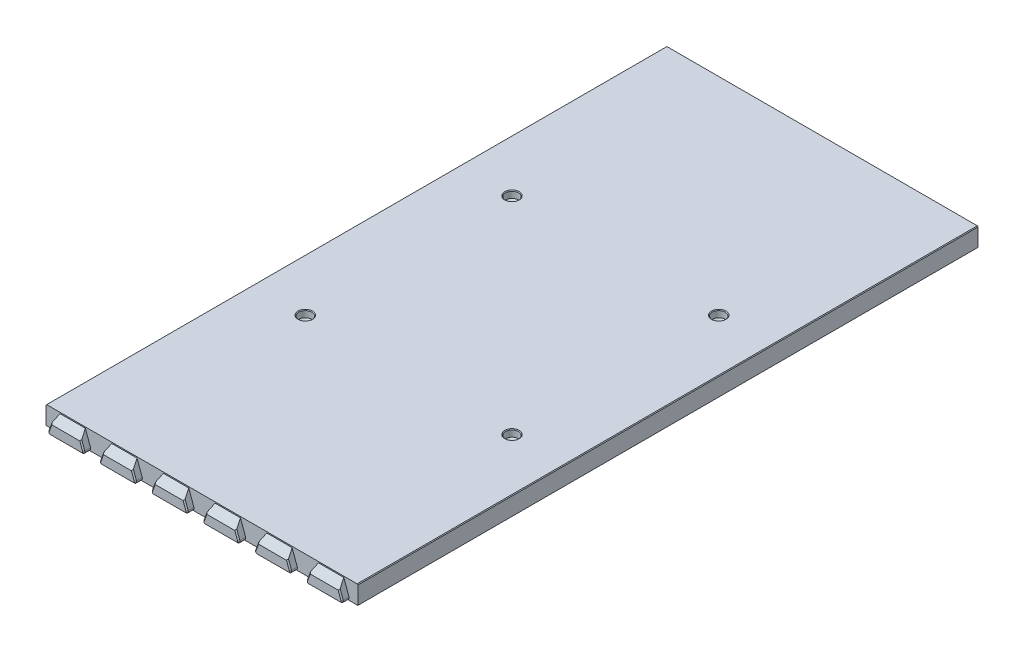
from build123d import *

# Parameters (mm, degrees)
BOSS_EXTRUDE1_DEPTH             = 135
SKETCH7_W                       = 131.75
SKETCH7_H                       = 6
BOSS_EXTRUDE7_DEPTH             = 1
BOSS_EXTRUDE4_DEPTH             = 3
BOSS_EXTRUDE8_REACH             = 153.314
BOSS_EXTRUDE8_DIRECTION_2_DEPTH = 2
CHAMFER4_SIZE                   = 0.5
FILLET4_R                       = 1
CHAMFER6_SIZE                   = 0.5
FILLET2_R                       = 2
CHAMFER4_OF_MIRROR2_SIZE        = 0.5
FILLET4_OF_MIRROR2_R            = 1
CHAMFER6_OF_MIRROR2_SIZE        = 0.5
FILLET2_OF_MIRROR2_R            = 2
BOSS_EXTRUDE9_REACH             = 283.425
SKETCH9_R                       = 5
FILLET3_R                       = 3
SKETCH10_R                      = 1.85
CUT_EXTRUDE2_DEPTH              = 282.42497335
SKETCH11_R                      = 2.85
CUT_EXTRUDE3_DEPTH              = 3
CHAMFER7_SIZE                   = 1
CUT_EXTRUDE4_DEPTH              = 282.42497335
CUT_EXTRUDE4_DEPTH_BACK         = 282.42497335
CHAMFER8_SIZE                   = 0.3


with BuildPart() as part:
    # Sketch1 → Boss-Extrude1 (new body)
    with BuildSketch(Plane.XY):
        Polygon((-67.875, 0), (-67.875, 8), (67.875, 8), (67.875, 0), (65.875, 0), (65.875, 6), (-65.875, 6), (-65.875, 0), align=None)
    boss_extrude1 = extrude(amount=-BOSS_EXTRUDE1_DEPTH)

    # Sketch7 → Boss-Extrude7 (add)
    with BuildSketch(Plane.XY):
        with Locations((0, 3)):
            Rectangle(SKETCH7_W, SKETCH7_H)
    boss_extrude7 = extrude(amount=-BOSS_EXTRUDE7_DEPTH)

    # Sketch2 → Boss-Extrude4 (add)
    with BuildSketch(Plane.XY):
        Polygon((50.911761874, 8), (48, 0), (64.5, 0), (61.588238126, 8), align=None)
        Polygon((28.411761874, 8), (25.5, 0), (42, 0), (39.088238126, 8), align=None)
        Polygon((5.911761874, 8), (3, 0), (19.5, 0), (16.588238126, 8), align=None)
        Polygon((-16.588238126, 8), (-19.5, 0), (-3, 0), (-5.911761874, 8), align=None)
        Polygon((-39.088238126, 8), (-42, 0), (-25.5, 0), (-28.411761874, 8), align=None)
        Polygon((-61.588238126, 8), (-64.5, 0), (-48, 0), (-50.911761874, 8), align=None)
    boss_extrude4 = extrude(amount=BOSS_EXTRUDE4_DEPTH)

    # Sketch8 → Boss-Extrude8 (add, up to next)
    with BuildSketch(Plane.XZ, mode=Mode.PRIVATE) as boss_extrude8_sk1:
        Polygon((-66.35, -20.258341264), (-62.65, -21.605031131), (-62.65, -23.394968869), (-66.35, -24.741658736), align=None)
    boss_extrude8_tool1 = extrude(boss_extrude8_sk1.sketch, amount=-BOSS_EXTRUDE8_REACH, mode=Mode.PRIVATE) - part.part
    # Sketch8 → Boss-Extrude8 (add, up to next)
    with BuildSketch(Plane.XZ, mode=Mode.PRIVATE) as boss_extrude8_sk2:
        Polygon((-66.35, -132.758341264), (-62.65, -134.105031131), (-62.65, -134.85), (-62.65, -135), (-66.35, -135), (-66.35, -134.85), align=None)
    boss_extrude8_tool2 = extrude(boss_extrude8_sk2.sketch, amount=-BOSS_EXTRUDE8_REACH, mode=Mode.PRIVATE) - part.part
    # Sketch8 → Boss-Extrude8 (add, up to next)
    with BuildSketch(Plane.XZ, mode=Mode.PRIVATE) as boss_extrude8_sk3:
        Polygon((66.35, -24.741658736), (66.35, -20.258341264), (62.65, -21.605031131), (62.65, -23.394968869), align=None)
    boss_extrude8_tool3 = extrude(boss_extrude8_sk3.sketch, amount=-BOSS_EXTRUDE8_REACH, mode=Mode.PRIVATE) - part.part
    # Sketch8 → Boss-Extrude8 (add, up to next)
    with BuildSketch(Plane.XZ, mode=Mode.PRIVATE) as boss_extrude8_sk4:
        Polygon((66.35, -135), (62.65, -135), (62.65, -134.85), (62.65, -134.105031131), (66.35, -132.758341264), (66.35, -134.85), align=None)
    boss_extrude8_tool4 = extrude(boss_extrude8_sk4.sketch, amount=-BOSS_EXTRUDE8_REACH, mode=Mode.PRIVATE) - part.part
    boss_extrude8_1 = boss_extrude8_tool1.solids().sort_by_distance((-64.764762, 0, -22.5))[0]
    add(boss_extrude8_1)
    boss_extrude8_2 = boss_extrude8_tool2.solids().sort_by_distance((-64.764762, 0, -134.16766))[0]
    add(boss_extrude8_2)
    boss_extrude8_3 = boss_extrude8_tool3.solids().sort_by_distance((64.764762, 0, -22.5))[0]
    add(boss_extrude8_3)
    boss_extrude8_4 = boss_extrude8_tool4.solids().sort_by_distance((64.764762, 0, -134.16766))[0]
    add(boss_extrude8_4)
    boss_extrude8 = boss_extrude8_1 + boss_extrude8_2 + boss_extrude8_3 + boss_extrude8_4  # Boss-Extrude8 as one shape, for the pattern or mirror that repeats it

    # Sketch8 → Boss-Extrude8 direction 2 (add)
    with BuildSketch(Plane.XZ):
        Polygon((-66.35, -20.258341264), (-62.65, -21.605031131), (-62.65, -23.394968869), (-66.35, -24.741658736), align=None)
        Polygon((-66.35, -132.758341264), (-62.65, -134.105031131), (-62.65, -134.85), (-62.65, -135), (-66.35, -135), (-66.35, -134.85), align=None)
        Polygon((66.35, -24.741658736), (66.35, -20.258341264), (62.65, -21.605031131), (62.65, -23.394968869), align=None)
        Polygon((66.35, -135), (62.65, -135), (62.65, -134.85), (62.65, -134.105031131), (66.35, -132.758341264), (66.35, -134.85), align=None)
    boss_extrude8_direction_2 = extrude(amount=BOSS_EXTRUDE8_DIRECTION_2_DEPTH)

    # Chamfer4
    chamfer4_edges = [part.edges().sort_by_distance(p)[0] for p in [
        (-66.35, -2, -22.5),
        (-64.5, -2, -24.068313803),
        (-62.65, -2, -22.5),
        (-64.5, -2, -20.931686197),
        (-66.35, -2, -133.879170632),
        (-62.65, -2, -134.552515565),
        (-64.5, -2, -133.431686197),
        (66.35, -2, -133.879170632),
        (64.5, -2, -133.431686197),
        (62.65, -2, -134.552515565),
        (64.5, -2, -24.068313803),
        (66.35, -2, -22.5),
        (64.5, -2, -20.931686197),
        (62.65, -2, -22.5),
    ]]
    chamfer(chamfer4_edges, length=CHAMFER4_SIZE)

    # Fillet4
    fillet4_edges = [part.edges().sort_by_distance(p)[0] for p in [
        (-64.5, 0, 1.5),
        (-48, 0, 1.5),
        (48, 0, 1.5),
        (64.5, 0, 1.5),
        (25.5, 0, 1.5),
        (42, 0, 1.5),
        (3, 0, 1.5),
        (19.5, 0, 1.5),
        (-42, 0, 1.5),
        (-25.5, 0, 1.5),
        (-19.5, 0, 1.5),
        (-3, 0, 1.5),
    ]]
    fillet(fillet4_edges, radius=FILLET4_R)

    # Chamfer6
    chamfer6_edges = [part.edges().sort_by_distance(p)[0] for p in [
        (-62.79989137, 4.671010072, 3),
        (62.79989137, 4.671010072, 3),
        (56.25, 0, 3),
        (33.75, 0, 3),
        (11.25, 0, 3),
        (-11.25, 0, 3),
        (-33.75, 0, 3),
        (-56.25, 0, 3),
        (48.608995962, 0.426423564, 3),
        (63.891004038, 0.426423564, 3),
        (40.29989137, 4.671010072, 3),
        (26.108995962, 0.426423564, 3),
        (41.391004038, 0.426423564, 3),
        (17.79989137, 4.671010072, 3),
        (3.608995962, 0.426423564, 3),
        (18.891004038, 0.426423564, 3),
        (-4.70010863, 4.671010072, 3),
        (-18.891004038, 0.426423564, 3),
        (-3.608995962, 0.426423564, 3),
        (-27.20010863, 4.671010072, 3),
        (-41.391004038, 0.426423564, 3),
        (-26.108995962, 0.426423564, 3),
        (-49.70010863, 4.671010072, 3),
        (-63.891004038, 0.426423564, 3),
        (-48.608995962, 0.426423564, 3),
        (49.70010863, 4.671010072, 3),
        (27.20010863, 4.671010072, 3),
        (4.70010863, 4.671010072, 3),
        (-40.29989137, 4.671010072, 3),
        (-17.79989137, 4.671010072, 3),
    ]]
    chamfer(chamfer6_edges, length=CHAMFER6_SIZE)

    # Fillet2
    fillet2_edges = [part.edges().sort_by_distance(p)[0] for p in [
        (-65.875, 6, -10.715613563),
        (-65.875, 3, -24.568772875),
        (-65.875, 3, -20.431227125),
        (-64.2625, 6, -23.981870872),
        (-64.2625, 6, -21.018129128),
        (-62.65, 6, -22.5),
        (-65.875, 6, -78.75),
        (-65.875, 3, -132.931227125),
        (-62.65, 6, -134.552515565),
        (-64.2625, 6, -133.518129128),
        (65.875, 6, -78.75),
        (65.875, 3, -132.931227125),
        (64.2625, 6, -133.518129128),
        (62.65, 6, -134.552515565),
        (65.875, 6, -10.715613563),
        (65.875, 3, -24.568772875),
        (65.875, 3, -20.431227125),
        (64.2625, 6, -23.981870872),
        (62.65, 6, -22.5),
        (64.2625, 6, -21.018129128),
        (-65.875, 3, -1),
        (0, 6, -1),
        (65.875, 3, -1),
    ]]
    fillet(fillet2_edges, radius=FILLET2_R)


with BuildPart() as mirror2_1:
    # Mirror2: Boss-Extrude1, Boss-Extrude7, Boss-Extrude4, Boss-Extrude8, Boss-Extrude8 direction 2 across plane
    add(boss_extrude1.mirror(Plane.XY.offset(-135)))
    add(boss_extrude7.mirror(Plane.XY.offset(-135)))
    add(boss_extrude4.mirror(Plane.XY.offset(-135)))
    add(boss_extrude8.mirror(Plane.XY.offset(-135)))
    add(boss_extrude8_direction_2.mirror(Plane.XY.offset(-135)))

    # Chamfer4 of Mirror2
    chamfer4_of_mirror2_edges = [mirror2_1.edges().sort_by_distance(p)[0] for p in [
        (-66.35, -2, -247.5),
        (-64.5, -2, -245.931686197),
        (-62.65, -2, -247.5),
        (-64.5, -2, -249.068313803),
        (-66.35, -2, -136.120829368),
        (-62.65, -2, -135.447484435),
        (-64.5, -2, -136.568313803),
        (66.35, -2, -136.120829368),
        (64.5, -2, -136.568313803),
        (62.65, -2, -135.447484435),
        (64.5, -2, -245.931686197),
        (66.35, -2, -247.5),
        (64.5, -2, -249.068313803),
        (62.65, -2, -247.5),
    ]]
    chamfer(chamfer4_of_mirror2_edges, length=CHAMFER4_OF_MIRROR2_SIZE)

    # Fillet4 of Mirror2
    fillet4_of_mirror2_edges = [mirror2_1.edges().sort_by_distance(p)[0] for p in [
        (-64.5, 0, -271.5),
        (-48, 0, -271.5),
        (48, 0, -271.5),
        (64.5, 0, -271.5),
        (25.5, 0, -271.5),
        (42, 0, -271.5),
        (3, 0, -271.5),
        (19.5, 0, -271.5),
        (-42, 0, -271.5),
        (-25.5, 0, -271.5),
        (-19.5, 0, -271.5),
        (-3, 0, -271.5),
    ]]
    fillet(fillet4_of_mirror2_edges, radius=FILLET4_OF_MIRROR2_R)

    # Chamfer6 of Mirror2
    chamfer6_of_mirror2_edges = [mirror2_1.edges().sort_by_distance(p)[0] for p in [
        (-62.79989137, 4.671010072, -273),
        (62.79989137, 4.671010072, -273),
        (56.25, 0, -273),
        (33.75, 0, -273),
        (11.25, 0, -273),
        (-11.25, 0, -273),
        (-33.75, 0, -273),
        (-56.25, 0, -273),
        (48.608995962, 0.426423564, -273),
        (63.891004038, 0.426423564, -273),
        (40.29989137, 4.671010072, -273),
        (26.108995962, 0.426423564, -273),
        (41.391004038, 0.426423564, -273),
        (17.79989137, 4.671010072, -273),
        (3.608995962, 0.426423564, -273),
        (18.891004038, 0.426423564, -273),
        (-4.70010863, 4.671010072, -273),
        (-18.891004038, 0.426423564, -273),
        (-3.608995962, 0.426423564, -273),
        (-27.20010863, 4.671010072, -273),
        (-41.391004038, 0.426423564, -273),
        (-26.108995962, 0.426423564, -273),
        (-49.70010863, 4.671010072, -273),
        (-63.891004038, 0.426423564, -273),
        (-48.608995962, 0.426423564, -273),
        (49.70010863, 4.671010072, -273),
        (27.20010863, 4.671010072, -273),
        (4.70010863, 4.671010072, -273),
        (-40.29989137, 4.671010072, -273),
        (-17.79989137, 4.671010072, -273),
    ]]
    chamfer(chamfer6_of_mirror2_edges, length=CHAMFER6_OF_MIRROR2_SIZE)

    # Fillet2 of Mirror2
    fillet2_of_mirror2_edges = [mirror2_1.edges().sort_by_distance(p)[0] for p in [
        (-65.875, 6, -259.284386437),
        (-65.875, 3, -245.431227125),
        (-65.875, 3, -249.568772875),
        (-64.2625, 6, -246.018129128),
        (-64.2625, 6, -248.981870872),
        (-62.65, 6, -247.5),
        (-65.875, 6, -191.25),
        (-65.875, 3, -137.068772875),
        (-62.65, 6, -135.447484435),
        (-64.2625, 6, -136.481870872),
        (65.875, 6, -191.25),
        (65.875, 3, -137.068772875),
        (64.2625, 6, -136.481870872),
        (62.65, 6, -135.447484435),
        (65.875, 6, -259.284386437),
        (65.875, 3, -245.431227125),
        (65.875, 3, -249.568772875),
        (64.2625, 6, -246.018129128),
        (62.65, 6, -247.5),
        (64.2625, 6, -248.981870872),
        (-65.875, 3, -269),
        (0, 6, -269),
        (65.875, 3, -269),
    ]]
    fillet(fillet2_of_mirror2_edges, radius=FILLET2_OF_MIRROR2_R)


with BuildPart() as part_1:
    add(part.part)

    # Mirror2 united with what the copies touc: union Mirror2_1
    add(mirror2_1.part)

    # Sketch9 → Boss-Extrude9 (add, up to next)
    with BuildSketch(Plane(origin=(0, 0, 0), x_dir=(1, 0, 0), z_dir=(0, 1, 0)), mode=Mode.PRIVATE) as boss_extrude9_sk1:
        with Locations(Location((-45, 90, 0), (0, 0, 90))):
            Circle(SKETCH9_R)
    boss_extrude9_tool1 = extrude(boss_extrude9_sk1.sketch, amount=BOSS_EXTRUDE9_REACH, mode=Mode.PRIVATE) - part_1.part
    # Sketch9 → Boss-Extrude9 (add, up to next)
    with BuildSketch(Plane(origin=(0, 0, 0), x_dir=(1, 0, 0), z_dir=(0, 1, 0)), mode=Mode.PRIVATE) as boss_extrude9_sk2:
        with Locations(Location((45, 90, 0), (0, 0, 90))):
            Circle(SKETCH9_R)
    boss_extrude9_tool2 = extrude(boss_extrude9_sk2.sketch, amount=BOSS_EXTRUDE9_REACH, mode=Mode.PRIVATE) - part_1.part
    # Sketch9 → Boss-Extrude9 (add, up to next)
    with BuildSketch(Plane(origin=(0, 0, 0), x_dir=(1, 0, 0), z_dir=(0, 1, 0)), mode=Mode.PRIVATE) as boss_extrude9_sk3:
        with Locations(Location((45, 180, 0), (0, 0, 90))):
            Circle(SKETCH9_R)
    boss_extrude9_tool3 = extrude(boss_extrude9_sk3.sketch, amount=BOSS_EXTRUDE9_REACH, mode=Mode.PRIVATE) - part_1.part
    # Sketch9 → Boss-Extrude9 (add, up to next)
    with BuildSketch(Plane(origin=(0, 0, 0), x_dir=(1, 0, 0), z_dir=(0, 1, 0)), mode=Mode.PRIVATE) as boss_extrude9_sk4:
        with Locations(Location((-45, 180, 0), (0, 0, 90))):
            Circle(SKETCH9_R)
    boss_extrude9_tool4 = extrude(boss_extrude9_sk4.sketch, amount=BOSS_EXTRUDE9_REACH, mode=Mode.PRIVATE) - part_1.part
    add(boss_extrude9_tool1.solids().sort_by_distance((-45, 0, -90))[0])
    add(boss_extrude9_tool2.solids().sort_by_distance((45, 0, -90))[0])
    add(boss_extrude9_tool3.solids().sort_by_distance((45, 0, -180))[0])
    add(boss_extrude9_tool4.solids().sort_by_distance((-45, 0, -180))[0])

    # Fillet3
    fillet3_edges = [part_1.edges().sort_by_distance(p)[0] for p in [
        (-45, 6, -85),
        (-45, 6, -175),
        (45, 6, -175),
        (45, 6, -85),
    ]]
    fillet(fillet3_edges, radius=FILLET3_R)

    # Sketch10 → Cut-Extrude2 (cut, through all)
    with BuildSketch(Plane(origin=(0, 0, 0), x_dir=(1, 0, 0), z_dir=(0, 1, 0))):
        with Locations(Location((-45, 180, 0), (0, 0, 270))):
            Circle(SKETCH10_R)
        with Locations(Location((-45, 90, 0), (0, 0, 270))):
            Circle(SKETCH10_R)
        with Locations(Location((45, 90, 0), (0, 0, 270))):
            Circle(SKETCH10_R)
        with Locations(Location((45, 180, 0), (0, 0, 270))):
            Circle(SKETCH10_R)
    extrude(amount=CUT_EXTRUDE2_DEPTH, mode=Mode.SUBTRACT)

    # Sketch11 → Cut-Extrude3 (cut)
    with BuildSketch(Plane(origin=(0, 8, 0), x_dir=(1, 0, 0), z_dir=(0, 1, 0))):
        with Locations(Location((-45, 180, 0), (0, 0, 270))):
            Circle(SKETCH11_R)
        with Locations(Location((45, 180, 0), (0, 0, 270))):
            Circle(SKETCH11_R)
        with Locations(Location((45, 90, 0), (0, 0, 270))):
            Circle(SKETCH11_R)
        with Locations(Location((-45, 90, 0), (0, 0, 270))):
            Circle(SKETCH11_R)
    extrude(amount=-CUT_EXTRUDE3_DEPTH, mode=Mode.SUBTRACT)

    # Chamfer7
    chamfer7_edges = [part_1.edges().sort_by_distance(p)[0] for p in [
        (-45, 5, -91.85),
        (45, 5, -91.85),
        (45, 5, -181.85),
        (-45, 5, -181.85),
    ]]
    chamfer(chamfer7_edges, length=CHAMFER7_SIZE - 0.0001)  # a hair under: the kernel refuses the full size

    # Sketch12 → Cut-Extrude4 (cut, two sides: drawn at the far end of the back side and taken through both)
    with BuildSketch(Plane(origin=(0, 0, 0), x_dir=(0, 0, -1), z_dir=(1, 0, 0)).offset(-CUT_EXTRUDE4_DEPTH_BACK)):
        Polygon((0, 7.5), (-3, 4.5), (-3, 7.5), (-3, 8), (0, 8), align=None)
        Polygon((273, 8), (273, 7.5), (273, 4.5), (270, 7.5), (270, 8), align=None)
    extrude(amount=CUT_EXTRUDE4_DEPTH + CUT_EXTRUDE4_DEPTH_BACK, mode=Mode.SUBTRACT)

    # Chamfer8
    chamfer8_edges = [part_1.edges().sort_by_distance(p)[0] for p in [
        (-45, 8, -92.85),
        (45, 8, -92.85),
        (45, 8, -182.85),
        (-45, 8, -182.85),
        (-67.875, 8, -135),
        (67.875, 8, -135),
    ]]
    chamfer(chamfer8_edges, length=CHAMFER8_SIZE)


solid = part_1.part
